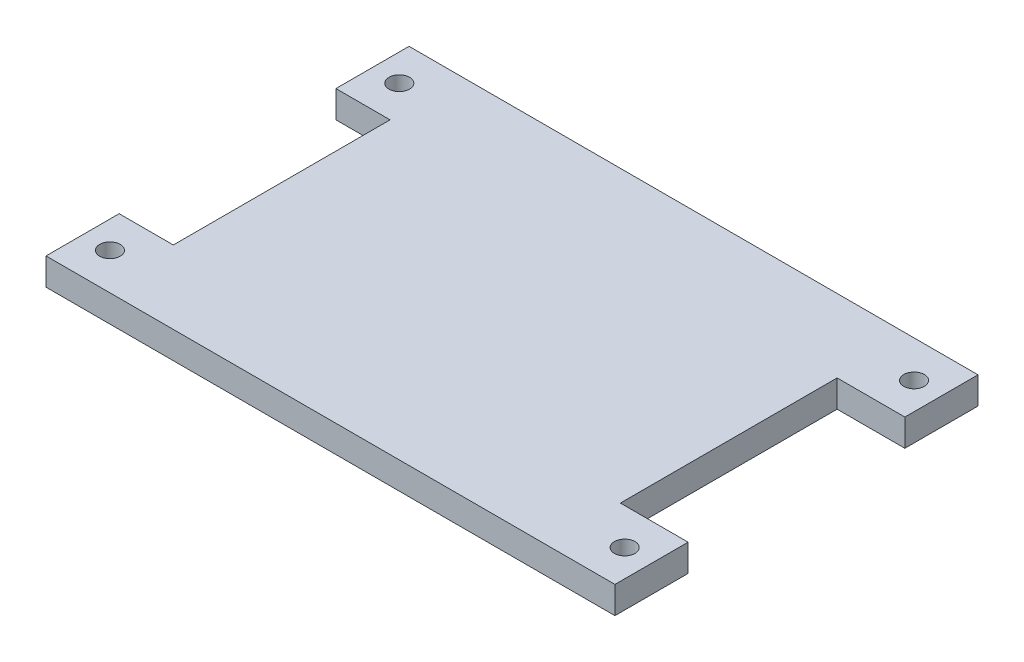
from build123d import *

# Parameters (mm, degrees)
SKETCH1_W           = 133.35
SKETCH1_H           = 85.09
BOSS_EXTRUDE1_DEPTH = 6.35
SKETCH4_W           = 15.875
SKETCH4_H           = 50.8
SKETCH4_W_2         = 12.7
CUT_EXTRUDE8_DEPTH  = 101.417876049
SKETCH2_R           = 2.413
CUT_EXTRUDE1_DEPTH  = 101.417876049


with BuildPart() as part:
    # Sketch1 → Boss-Extrude1 (new body)
    with BuildSketch(Plane(origin=(0, 0, 0), x_dir=(1, 0, 0), z_dir=(0, 1, 0))):
        with Locations((21.486627907, 5.109534884)):
            Rectangle(SKETCH1_W, SKETCH1_H)
    extrude(amount=BOSS_EXTRUDE1_DEPTH)

    # Sketch4 → Cut-Extrude8 (cut, through all)
    with BuildSketch(Plane(origin=(0, 6.35, 0), x_dir=(1, 0, 0), z_dir=(0, 1, 0))):
        with Locations((80.224127907, 5.109534884)):
            Rectangle(SKETCH4_W, SKETCH4_H)
        with Locations((-38.838372093, 5.109534884)):
            Rectangle(SKETCH4_W_2, SKETCH4_H)
    extrude(amount=-CUT_EXTRUDE8_DEPTH, mode=Mode.SUBTRACT)

    # Sketch2 → Cut-Extrude1 (cut, through all)
    with BuildSketch(Plane(origin=(0, 6.35, 0), x_dir=(1, 0, 0), z_dir=(0, 1, 0))):
        with Locations((81.811627907, -28.799465116)):
            Circle(SKETCH2_R)
        with Locations((81.811627907, 39.018534884)):
            Circle(SKETCH2_R)
        with Locations((-38.838372093, 39.018534884)):
            Circle(SKETCH2_R)
        with Locations((-38.838372093, -28.799465116)):
            Circle(SKETCH2_R)
    extrude(amount=-CUT_EXTRUDE1_DEPTH, mode=Mode.SUBTRACT)


solid = part.part
